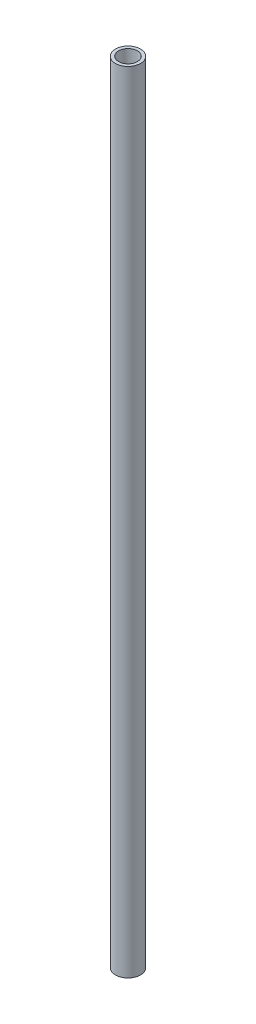
from build123d import *

# Parameters (mm, degrees)
SKETCH1_R           = 6.35
SKETCH1_R_2         = 4.7625
BOSS_EXTRUDE1_DEPTH = 400.304


with BuildPart() as part:
    # Sketch1 → Boss-Extrude1 (new body)
    with BuildSketch(Plane(origin=(0, 0, 0), x_dir=(1, 0, 0), z_dir=(0, 1, 0))):
        Circle(SKETCH1_R)
        Circle(SKETCH1_R_2, mode=Mode.SUBTRACT)
    extrude(amount=BOSS_EXTRUDE1_DEPTH)


solid = part.part
